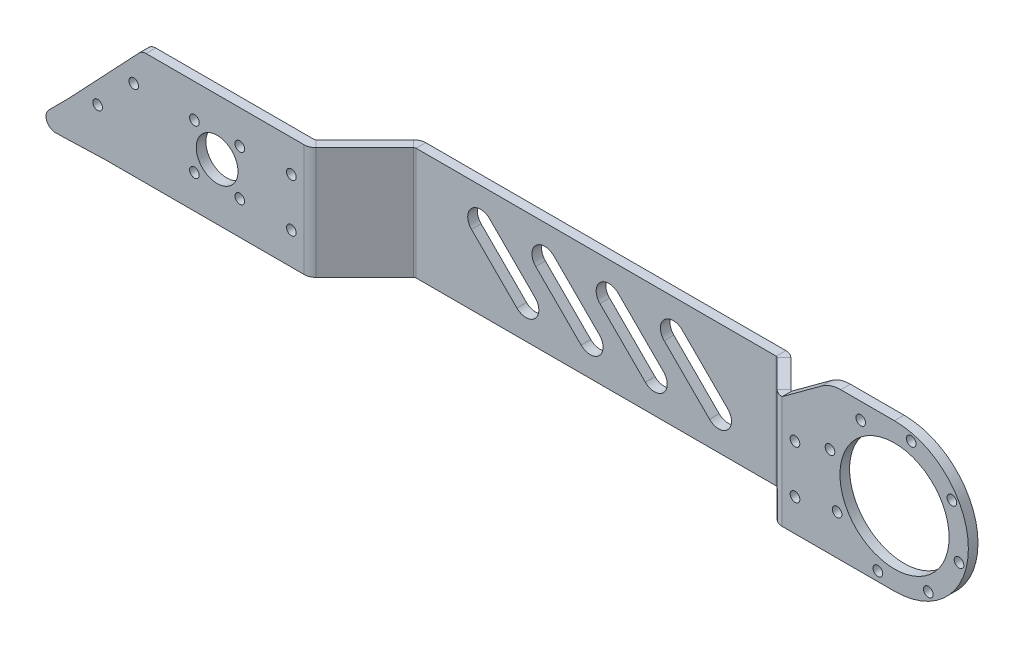
from build123d import *

# Parameters (mm, degrees)
SKETCH_1_R               = 6.5
SKETCH_1_R_2             = 1.5
SM_BASE_FLANGE_1_DEPTH   = 3
OTHER_START              = -17.5
OTHER_1_DEPTH            = 35
OTHER_1_2_DEPTH          = 35
FILLET_1_R               = 5
EXTRUDE_START            = -3
EXTRUDE_1_OUTLINE_W      = 142
EXTRUDE_1_OUTLINE_H      = 35
EXTRUDE_1_DEPTH          = 3
OTHER_2_DEPTH            = 35
OTHER_2_2_DEPTH          = 35
SKETCH_9_W               = 40.525450659
SKETCH_9_H               = 35
CUT_EXTRUDE_1_DEPTH      = 212.62821173
EXTRUDE_START_2          = -6.5
SKETCH_10_R              = 23
SKETCH_10_R_2            = 20.75
SKETCH_10_R_3            = 17
EXTRUDE_2_DEPTH          = 3
FILLET_2_R               = 10
SKETCH_15_R              = 1.5
CUT_EXTRUDE_2_DEPTH      = 230.621254674
CUT_EXTRUDE_4_DEPTH      = 3
CUT_EXTRUDE_6_DEPTH      = 231.080791458
CUT_EXTRUDE_6_DEPTH_BACK = 231.080791458
SKETCH_21_R              = 1.5
CUT_EXTRUDE_7_DEPTH      = 230.845971463
CUT_EXTRUDE_7_DEPTH_BACK = 230.845971463
SKETCH_24_R              = 1.5
SKETCH_24_R_2            = 6.5
EXTRUDE_3_DEPTH          = 3


# Read off the part's stored shape, not the designer's step: 转折1, 凸台-拉伸1, 转折2
# Sheet-metal steps are written as plain solids
with BuildPart() as part:
    # Sketch 1 → 基体-法兰1 (new body)
    with BuildSketch(Plane.XY):
        with BuildLine():
            Line((-55, -2.5), (-55, 17.5))
            Line((-55, 17.5), (-25, 17.5))
            Line((-25, 17.5), (25, 17.5))
            Line((25, 17.5), (68, 17.5))
            Line((68, 17.5), (68, -17.5))
            Line((68, -17.5), (25, -17.5))
            Line((25, -17.5), (-25, -17.5))
            Line((-25, -17.5), (-35, -17.5))
            ThreePointArc((-35, -17.5), (-44.006294251, -8.675059002), (-55, -2.5))
        make_face()
        Circle(SKETCH_1_R, mode=Mode.SUBTRACT)
        with Locations((7.071067812, 7.071067812)):
            Circle(SKETCH_1_R_2, mode=Mode.SUBTRACT)
        with Locations((7.071067812, -7.071067812)):
            Circle(SKETCH_1_R_2, mode=Mode.SUBTRACT)
        with Locations((-7.071067812, -7.071067812)):
            Circle(SKETCH_1_R_2, mode=Mode.SUBTRACT)
        with Locations((-7.071067812, 7.071067812)):
            Circle(SKETCH_1_R_2, mode=Mode.SUBTRACT)
    extrude(amount=-SM_BASE_FLANGE_1_DEPTH)

    # Other 1 outline → Other 1 (cut)
    with BuildSketch(Plane(origin=(0, 0, 0), x_dir=(1, 0, 0), z_dir=(0, 1, 0)).offset(OTHER_START)):
        with BuildLine():
            Line((68, 3), (31.669439631, 3))
            Line((31.669439631, 3), (29.763864432, 1.094424801))
            ThreePointArc((29.763864432, 1.094424801), (28.551624147, 0.284431739), (27.121689234, 0))
            Line((27.121689234, 0), (68, 0))
            Line((68, 0), (68, 3))
        make_face()
    extrude(amount=OTHER_1_DEPTH, mode=Mode.SUBTRACT)

    # Other 1 2 outline → Other 1 2 (add)
    with BuildSketch(Plane(origin=(0, 0, 0), x_dir=(1, 0, 0), z_dir=(0, 1, 0)).offset(OTHER_START)):
        with BuildLine():
            ThreePointArc((45.474549341, 19.5), (44.044614428, 19.215568261), (42.832374142, 18.405575199))
            Line((42.832374142, 18.405575199), (27.642544089, 3.215745145))
            ThreePointArc((27.642544089, 3.215745145), (27.40357385, 3.056070336), (27.121689234, 3))
            Line((27.121689234, 3), (31.669439631, 3))
            Line((31.669439631, 3), (44.953694486, 16.284254855))
            ThreePointArc((44.953694486, 16.284254855), (45.192664725, 16.443929664), (45.474549341, 16.5))
            Line((45.474549341, 16.5), (68, 16.5))
            Line((68, 16.5), (68, 19.5))
            Line((68, 19.5), (45.474549341, 19.5))
        make_face()
    extrude(amount=OTHER_1_2_DEPTH)

    # 圆角1
    fillet_1_edges = [part.edges().sort_by_distance(p)[0] for p in [
        (-55, -2.5, -1.5),
        (-35, -17.5, -1.5),
        (-55, 17.5, -1.5),
    ]]
    fillet(fillet_1_edges, radius=FILLET_1_R)

    # 凸台-拉伸1 outline → 凸台-拉伸1 (add)
    with BuildSketch(Plane.XY.offset(-16.5).offset(EXTRUDE_START)):
        with Locations((139, 0)):
            Rectangle(EXTRUDE_1_OUTLINE_W, EXTRUDE_1_OUTLINE_H)
    extrude(amount=EXTRUDE_1_DEPTH)

    # Other 2 outline → Other 2 (cut)
    with BuildSketch(Plane(origin=(0, 0, 0), x_dir=(1, 0, 0), z_dir=(0, 1, 0)).offset(OTHER_START)):
        with BuildLine():
            Line((210, 19.5), (157.621689234, 19.5))
            ThreePointArc((157.621689234, 19.5), (159.051624147, 19.215568261), (160.263864432, 18.405575199))
            Line((160.263864432, 18.405575199), (162.169439631, 16.5))
            Line((162.169439631, 16.5), (210, 16.5))
            Line((210, 16.5), (210, 19.5))
        make_face()
    extrude(amount=OTHER_2_DEPTH, mode=Mode.SUBTRACT)

    # Other 2 2 outline → Other 2 2 (add)
    with BuildSketch(Plane(origin=(0, 0, 0), x_dir=(1, 0, 0), z_dir=(0, 1, 0)).offset(OTHER_START)):
        with BuildLine():
            Line((168.953694486, 9.715745145), (162.169439631, 16.5))
            Line((162.169439631, 16.5), (157.621689234, 16.5))
            ThreePointArc((157.621689234, 16.5), (157.90357385, 16.443929664), (158.142544089, 16.284254855))
            Line((158.142544089, 16.284254855), (166.832374142, 7.594424801))
            ThreePointArc((166.832374142, 7.594424801), (168.044614428, 6.784431739), (169.474549341, 6.5))
            Line((169.474549341, 6.5), (210, 6.5))
            Line((210, 6.5), (210, 9.5))
            Line((210, 9.5), (169.474549341, 9.5))
            ThreePointArc((169.474549341, 9.5), (169.192664725, 9.556070336), (168.953694486, 9.715745145))
        make_face()
    extrude(amount=OTHER_2_2_DEPTH)

    # 草图9 → 切除-拉伸1 (cut, through all)
    with BuildSketch(Plane.XY):
        with Locations((189.73727467, 0)):
            Rectangle(SKETCH_9_W, SKETCH_9_H)
    extrude(amount=-CUT_EXTRUDE_1_DEPTH, mode=Mode.SUBTRACT)

    # 草图10 → 凸台-拉伸2 (add)
    # profile 1 of 4: a face of its own
    with BuildSketch(Plane.XY.offset(EXTRUDE_START_2)):
        with BuildLine():
            ThreePointArc((157.474549341, 5.5), (118.211093374, 21.763455967), (134.474549341, -17.5))
            ThreePointArc((134.474549341, -17.5), (150.738005308, -10.763455967), (157.474549341, 5.5))
        make_face()
    # profile 2 of 4: a face of its own
    with BuildSketch(Plane.XY.offset(EXTRUDE_START_2)):
        with BuildLine():
            Line((169.474549341, 17.5), (169.474549341, -17.5))
            Line((169.474549341, -17.5), (204.474549341, -17.5))
            ThreePointArc((204.474549341, -17.5), (181.474549341, 5.5), (204.474549341, 28.5))
            Line((204.474549341, 28.5), (184.474549341, 28.5))
            Line((184.474549341, 28.5), (169.474549341, 17.5))
        make_face()
    # profile 3 of 4: a face of its own
    with BuildSketch(Plane.XY.offset(EXTRUDE_START_2)):
        with Locations((204.474549341, 5.5)):
            Circle(SKETCH_10_R)
        with Locations((204.474549341, 5.5)):
            Circle(SKETCH_10_R_2, mode=Mode.SUBTRACT)
    # profile 4 of 4: a face of its own
    with BuildSketch(Plane.XY.offset(EXTRUDE_START_2)):
        with Locations((204.474549341, 5.5)):
            Circle(SKETCH_10_R_2)
        with Locations((204.474549341, 5.5)):
            Circle(SKETCH_10_R_3, mode=Mode.SUBTRACT)
    extrude(amount=-EXTRUDE_2_DEPTH)


with BuildPart() as extrude_2_kept_piece:
    # of the separate pieces the step leaves, the one the design keeps (extrude_2_pieces_kept)
    add(part.part.solids().sort_by_distance((-36.426633909, -15.761798019, 0))[0])

    # 圆角2
    fillet_2_edges = [extrude_2_kept_piece.edges().sort_by_distance(p)[0] for p in [
        (184.474549341, 28.5, -8),
    ]]
    fillet(fillet_2_edges, radius=FILLET_2_R)

    # 草图15 → 切除-拉伸2 (cut, through all)
    with BuildSketch(Plane(origin=(0, 0, -6.5), x_dir=(-1, 0, 0), z_dir=(0, 0, -1))):
        with Locations(Location((-209.669934425, 25.589063538, 0), (0, 0, 180))):
            Circle(SKETCH_15_R)
        with Locations(Location((-193.94312831, 23.378805079, 0), (0, 0, 180))):
            Circle(SKETCH_15_R)
        with Locations(Location((-184.385485803, 10.695385084, 0), (0, 0, 180))):
            Circle(SKETCH_15_R)
        with Locations(Location((-186.595744262, -5.031421031, 0), (0, 0, 180))):
            Circle(SKETCH_15_R)
        with Locations(Location((-199.279164257, -14.589063538, 0), (0, 0, 180))):
            Circle(SKETCH_15_R)
        with Locations(Location((-215.005970373, -12.378805079, 0), (0, 0, 180))):
            Circle(SKETCH_15_R)
        with Locations(Location((-224.563612879, 0.304614916, 0), (0, 0, 180))):
            Circle(SKETCH_15_R)
        with Locations(Location((-222.35335442, 16.031421031, 0), (0, 0, 180))):
            Circle(SKETCH_15_R)
    extrude(amount=CUT_EXTRUDE_2_DEPTH, mode=Mode.SUBTRACT)

    # 草图18 → 切除-拉伸4 (cut)
    with BuildSketch(Plane.XY):
        with BuildLine():
            Line((-32.637085957, -17.5), (-16.817614436, -17.5))
            Line((-16.817614436, -17.5), (-16.817614436, 17.5))
            Line((-16.817614436, 17.5), (-50, 17.5))
            ThreePointArc((-50, 17.5), (-53.535533906, 16.035533906), (-55, 12.5))
            Line((-55, 12.5), (-55, 0.76710799))
            ThreePointArc((-55, 0.76710799), (-54.228338088, -1.901441619), (-52.151537194, -3.74630399))
            ThreePointArc((-52.151537194, -3.74630399), (-43.663126678, -8.93484684), (-36.426633909, -15.761798019))
            ThreePointArc((-36.426633909, -15.761798019), (-34.721673435, -17.044721669), (-32.637085957, -17.5))
        make_face()
    extrude(amount=-CUT_EXTRUDE_4_DEPTH, mode=Mode.SUBTRACT)

    # 草图21 → 切除-拉伸6 (cut, two sides: drawn at the far end of the back side and taken through both)
    with BuildSketch(Plane.XY.offset(-CUT_EXTRUDE_6_DEPTH_BACK)):
        with Locations((173.474549341, 7.5)):
            Circle(SKETCH_21_R)
        with Locations((173.474549341, -7.5)):
            Circle(SKETCH_21_R)
        with Locations(Location((23.121689234, 7.5, 0), (0, 0, 180))):
            Circle(SKETCH_21_R)
        with Locations(Location((23.121689234, -7.5, 0), (0, 0, 180))):
            Circle(SKETCH_21_R)
    extrude(amount=CUT_EXTRUDE_6_DEPTH + CUT_EXTRUDE_6_DEPTH_BACK, mode=Mode.SUBTRACT)

    # 草图22 → 切除-拉伸7 (cut, two sides: drawn at the far end of the back side and taken through both)
    with BuildSketch(Plane.XY.offset(-16.5).offset(-CUT_EXTRUDE_7_DEPTH_BACK)):
        with BuildLine():
            Line((128.379048547, 9.899494937), (142.52118417, -4.242640687))
            ThreePointArc((142.52118417, -4.242640687), (142.52118417, -9.899494937), (136.864329921, -9.899494937))
            Line((136.864329921, -9.899494937), (122.722194297, 4.242640687))
            ThreePointArc((122.722194297, 4.242640687), (122.722194297, 9.899494937), (128.379048547, 9.899494937))
        make_face()
        with BuildLine():
            Line((108.379048547, 9.899494937), (122.52118417, -4.242640687))
            ThreePointArc((122.52118417, -4.242640687), (122.52118417, -9.899494937), (116.864329921, -9.899494937))
            Line((116.864329921, -9.899494937), (102.722194297, 4.242640687))
            ThreePointArc((102.722194297, 4.242640687), (102.722194297, 9.899494937), (108.379048547, 9.899494937))
        make_face()
        with BuildLine():
            Line((88.379048547, 9.899494937), (102.52118417, -4.242640687))
            ThreePointArc((102.52118417, -4.242640687), (102.52118417, -9.899494937), (96.864329921, -9.899494937))
            Line((96.864329921, -9.899494937), (82.722194297, 4.242640687))
            ThreePointArc((82.722194297, 4.242640687), (82.722194297, 9.899494937), (88.379048547, 9.899494937))
        make_face()
        with BuildLine():
            Line((68.379048547, 9.899494937), (82.52118417, -4.242640687))
            ThreePointArc((82.52118417, -4.242640687), (82.52118417, -9.899494937), (76.864329921, -9.899494937))
            Line((76.864329921, -9.899494937), (62.722194297, 4.242640687))
            ThreePointArc((62.722194297, 4.242640687), (62.722194297, 9.899494937), (68.379048547, 9.899494937))
        make_face()
    extrude(amount=CUT_EXTRUDE_7_DEPTH + CUT_EXTRUDE_7_DEPTH_BACK, mode=Mode.SUBTRACT)

    # 草图24 → 凸台-拉伸3 (add)
    with BuildSketch(Plane.XY):
        with BuildLine():
            Line((-46.494570055, -6.929160459), (-52.418783312, -12.853373716))
            ThreePointArc((-52.418783312, -12.853373716), (-53.03967847, -16.191351014), (-50.14822115, -17.970979573))
            ThreePointArc((-50.14822115, -17.970979573), (-49.198451339, -17.941204792), (-48.248229397, -17.946448179))
            Line((-48.248229397, -17.946448179), (-35, -17.5))
            Line((-35, -17.5), (27.121689234, -17.5))
            Line((27.121689234, -17.5), (27.121689234, 17.5))
            Line((27.121689234, 17.5), (-22.11692418, 17.5))
            ThreePointArc((-22.11692418, 17.5), (-23.304052097, 17.255127458), (-24.297383327, 16.560484872))
            Line((-24.297383327, 16.560484872), (-46.494570055, -6.929160459))
        make_face()
        with Locations((-7.071067812, 7.071067812)):
            Circle(SKETCH_24_R, mode=Mode.SUBTRACT)
        with Locations((-7.071067812, -7.071067812)):
            Circle(SKETCH_24_R, mode=Mode.SUBTRACT)
        with Locations((7.071067812, -7.071067812)):
            Circle(SKETCH_24_R, mode=Mode.SUBTRACT)
        with Locations((7.071067812, 7.071067812)):
            Circle(SKETCH_24_R, mode=Mode.SUBTRACT)
        Circle(SKETCH_24_R_2, mode=Mode.SUBTRACT)
        with Locations((-37.211455917, -3.895419416)):
            Circle(SKETCH_24_R, mode=Mode.SUBTRACT)
        with Locations((-25.980052784, 7.5)):
            Circle(SKETCH_24_R, mode=Mode.SUBTRACT)
        with Locations(Location((23.121689234, 7.5, 0), (0, 0, 180.000000002))):
            Circle(SKETCH_24_R, mode=Mode.SUBTRACT)
        with Locations(Location((23.121689234, -7.5, 0), (0, 0, 180.000000002))):
            Circle(SKETCH_24_R, mode=Mode.SUBTRACT)
    extrude(amount=-EXTRUDE_3_DEPTH)


solid = extrude_2_kept_piece.part
